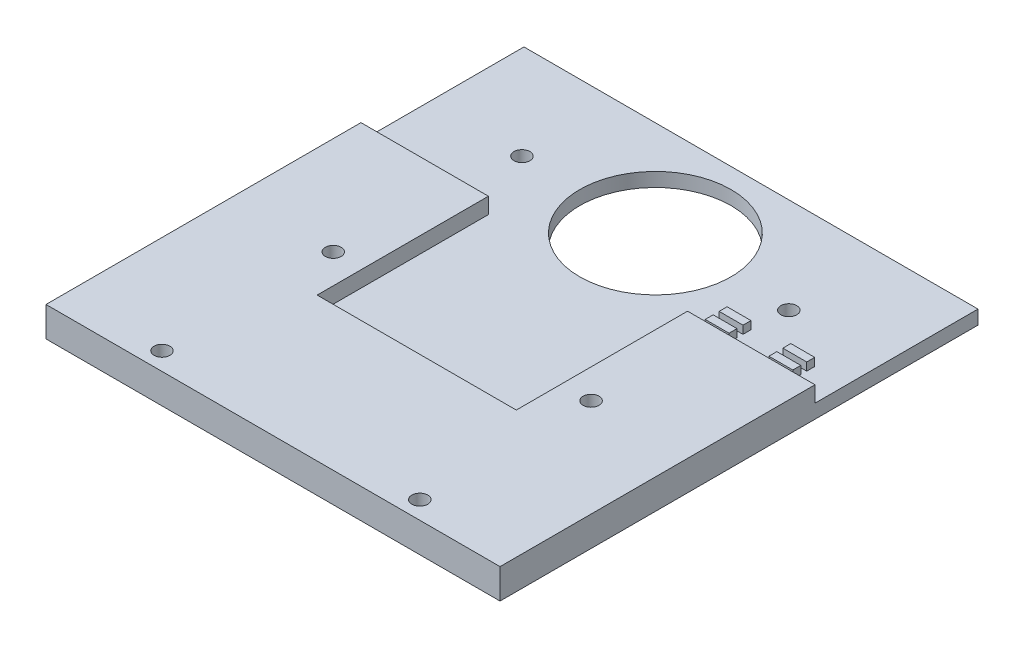
from build123d import *

# Parameters (mm, degrees)
SKIZZE1_W                       = 57
SKIZZE1_H                       = 60
AUFSATZ_LINEAR_AUSTRAGEN1_DEPTH = 1.75
SKIZZE3_R                       = 9.495370676
SCHNITT_LINEAR_AUSTRAGEN1_DEPTH = 2
SKIZZE4_W                       = 57
SKIZZE4_H                       = 39.538579665
AUFSATZ_LINEAR_AUSTRAGEN2_DEPTH = 2
SKIZZE5_R                       = 1
SCHNITT_LINEAR_AUSTRAGEN2_DEPTH = 4
SKIZZE10_R                      = 1
SCHNITT_LINEAR_AUSTRAGEN3_DEPTH = 2
SKIZZE13_W                      = 3
SKIZZE13_H                      = 1
AUFSATZ_LINEAR_AUSTRAGEN6_DEPTH = 1
SKIZZE14_W                      = 25
SKIZZE14_H                      = 21.5
SCHNITT_LINEAR_AUSTRAGEN4_DEPTH = 2


with BuildPart() as part:
    # Skizze1 → Aufsatz-Linear austragen1 (new body)
    with BuildSketch(Plane(origin=(0, 0, 0), x_dir=(1, 0, 0), z_dir=(0, 1, 0))):
        with Locations((28.5, 30)):
            Rectangle(SKIZZE1_W, SKIZZE1_H)
    extrude(amount=-AUFSATZ_LINEAR_AUSTRAGEN1_DEPTH)

    # Skizze3 → Schnitt-Linear austragen1 (cut)
    with BuildSketch(Plane(origin=(0, 0, 0), x_dir=(1, 0, 0), z_dir=(0, 1, 0))):
        with Locations((28.5, 48)):
            Circle(SKIZZE3_R)
    extrude(amount=-SCHNITT_LINEAR_AUSTRAGEN1_DEPTH, mode=Mode.SUBTRACT)

    # Skizze4 → Aufsatz-Linear austragen2 (add)
    with BuildSketch(Plane(origin=(0, 0, 0), x_dir=(1, 0, 0), z_dir=(0, 1, 0))):
        with Locations((28.5, 19.769289833)):
            Rectangle(SKIZZE4_W, SKIZZE4_H)
    extrude(amount=AUFSATZ_LINEAR_AUSTRAGEN2_DEPTH)

    # Skizze5 → Schnitt-Linear austragen2 (cut)
    with BuildSketch(Plane(origin=(0, 2, 0), x_dir=(1, 0, 0), z_dir=(0, 1, 0))):
        with Locations((12.315263515, 23.744868689)):
            Circle(SKIZZE5_R)
        with Locations((12.315263515, 2.244868689)):
            Circle(SKIZZE5_R)
    schnitt_linear_austragen2 = extrude(amount=-SCHNITT_LINEAR_AUSTRAGEN2_DEPTH, mode=Mode.SUBTRACT)

    # Spiegeln1: Schnitt-Linear austragen2 across plane
    add(schnitt_linear_austragen2.mirror(Plane.ZY.offset(-28.5)), mode=Mode.SUBTRACT)

    # Skizze10 → Schnitt-Linear austragen3 (cut)
    with BuildSketch(Plane(origin=(0, 0, 0), x_dir=(1, 0, 0), z_dir=(0, 1, 0))):
        with Locations((45.25, 48)):
            Circle(SKIZZE10_R)
        with Locations((11.75, 48)):
            Circle(SKIZZE10_R)
    extrude(amount=-SCHNITT_LINEAR_AUSTRAGEN3_DEPTH, mode=Mode.SUBTRACT)

    # Skizze13 → Aufsatz-Linear austragen6 (add)
    with BuildSketch(Plane(origin=(0, 0, 0), x_dir=(1, 0, 0), z_dir=(0, 1, 0))):
        with Locations((51.5, 43)):
            Rectangle(SKIZZE13_W, SKIZZE13_H)
        with Locations((43.5, 43)):
            Rectangle(SKIZZE13_W, SKIZZE13_H)
        with Locations((51.5, 41.25)):
            Rectangle(SKIZZE13_W, SKIZZE13_H)
        with Locations((43.5, 41.25)):
            Rectangle(SKIZZE13_W, SKIZZE13_H)
    extrude(amount=AUFSATZ_LINEAR_AUSTRAGEN6_DEPTH)

    # Skizze14 → Schnitt-Linear austragen4 (cut)
    with BuildSketch(Plane(origin=(0, 2, 0), x_dir=(1, 0, 0), z_dir=(0, 1, 0))):
        with Locations((28.5, 28.788579665)):
            Rectangle(SKIZZE14_W, SKIZZE14_H)
    extrude(amount=-SCHNITT_LINEAR_AUSTRAGEN4_DEPTH, mode=Mode.SUBTRACT)


solid = part.part
